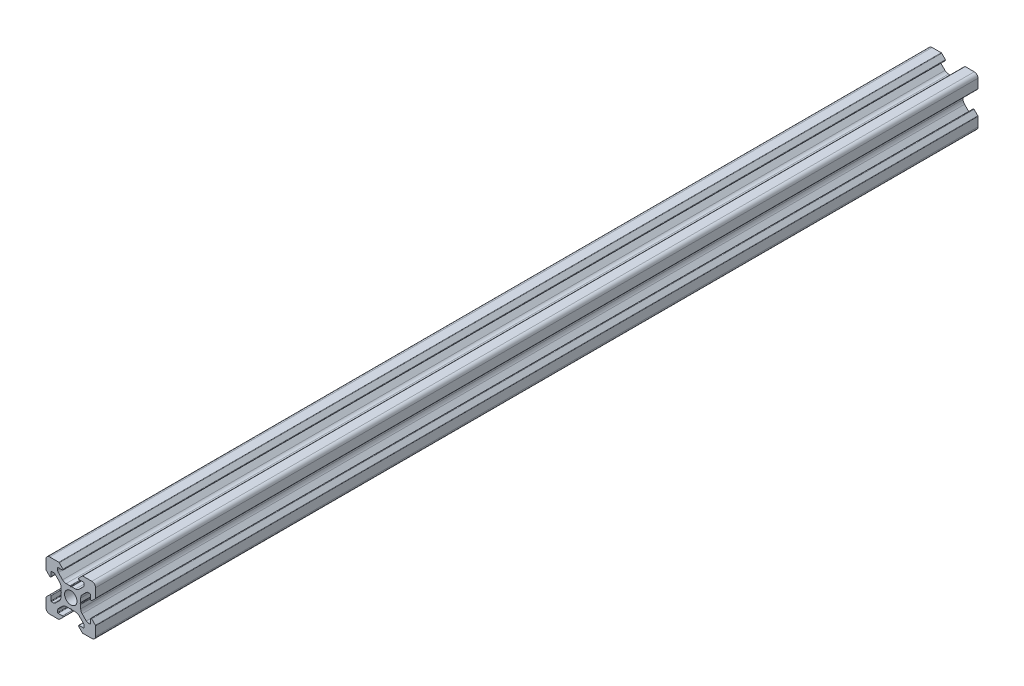
from build123d import *

# Parameters (mm, degrees)
MODEL_R            = 2.5
EXTRUDE_BODY_DEPTH = 356


with BuildPart() as part:
    # Model → Extrude body (new body)
    with BuildSketch(Plane.XY):
        with BuildLine():
            Line((-4, 0.337695265), (-4, 1.898780669))
            ThreePointArc((-4, 1.898780669), (-4.152240935, 2.664147534), (-4.585786438, 3.312994231))
            Line((-4.585786438, 3.312994231), (-6.279898987, 5.007106781))
            ThreePointArc((-6.279898987, 5.007106781), (-6.604322336, 5.223879533), (-6.987005769, 5.3))
            Line((-6.987005769, 5.3), (-7.8, 5.3))
            ThreePointArc((-7.8, 5.3), (-7.941421356, 5.241421356), (-8, 5.1))
            Line((-8, 5.1), (-8, 3.33))
            ThreePointArc((-8, 3.33), (-8.154329142, 3.099030117), (-8.426776695, 3.153223305))
            Line((-8.426776695, 3.153223305), (-9.926776695, 4.653223305))
            ThreePointArc((-9.926776695, 4.653223305), (-9.980969883, 4.734329142), (-10, 4.83))
            Line((-10, 4.83), (-10, 8.5))
            ThreePointArc((-10, 8.5), (-9.560660172, 9.560660172), (-8.5, 10))
            Line((-8.5, 10), (-4.83, 10))
            ThreePointArc((-4.83, 10), (-4.734329142, 9.980969883), (-4.653223305, 9.926776695))
            Line((-4.653223305, 9.926776695), (-3.153223305, 8.426776695))
            ThreePointArc((-3.153223305, 8.426776695), (-3.099030117, 8.154329142), (-3.33, 8))
            Line((-3.33, 8), (-5.1, 8))
            ThreePointArc((-5.1, 8), (-5.241421356, 7.941421356), (-5.3, 7.8))
            Line((-5.3, 7.8), (-5.3, 6.987005769))
            ThreePointArc((-5.3, 6.987005769), (-5.223879533, 6.604322336), (-5.007106781, 6.279898987))
            Line((-5.007106781, 6.279898987), (-3.312994231, 4.585786438))
            ThreePointArc((-3.312994231, 4.585786438), (-2.664147534, 4.152240935), (-1.898780669, 4))
            Line((-1.898780669, 4), (-0.337695265, 4))
            ThreePointArc((-0.337695265, 4), (-0.254943529, 3.98590708), (-0.181521503, 3.945217202))
            Line((-0.181521503, 3.945217202), (0, 3.8))
            Line((0, 3.8), (0.181521503, 3.945217202))
            ThreePointArc((0.181521503, 3.945217202), (0.254943529, 3.98590708), (0.337695265, 4))
            Line((0.337695265, 4), (1.898780669, 4))
            ThreePointArc((1.898780669, 4), (2.664147534, 4.152240935), (3.312994231, 4.585786438))
            Line((3.312994231, 4.585786438), (5.007106781, 6.279898987))
            ThreePointArc((5.007106781, 6.279898987), (5.223879533, 6.604322336), (5.3, 6.987005769))
            Line((5.3, 6.987005769), (5.3, 7.8))
            ThreePointArc((5.3, 7.8), (5.241421356, 7.941421356), (5.1, 8))
            Line((5.1, 8), (3.33, 8))
            ThreePointArc((3.33, 8), (3.099030117, 8.154329142), (3.153223305, 8.426776695))
            Line((3.153223305, 8.426776695), (4.653223305, 9.926776695))
            ThreePointArc((4.653223305, 9.926776695), (4.734329142, 9.980969883), (4.83, 10))
            Line((4.83, 10), (8.5, 10))
            ThreePointArc((8.5, 10), (9.560660172, 9.560660172), (10, 8.5))
            Line((10, 8.5), (10, 4.83))
            ThreePointArc((10, 4.83), (9.980969883, 4.734329142), (9.926776695, 4.653223305))
            Line((9.926776695, 4.653223305), (8.426776695, 3.153223305))
            ThreePointArc((8.426776695, 3.153223305), (8.154329142, 3.099030117), (8, 3.33))
            Line((8, 3.33), (8, 5.1))
            ThreePointArc((8, 5.1), (7.941421356, 5.241421356), (7.8, 5.3))
            Line((7.8, 5.3), (6.987005769, 5.3))
            ThreePointArc((6.987005769, 5.3), (6.604322336, 5.223879533), (6.279898987, 5.007106781))
            Line((6.279898987, 5.007106781), (4.585786438, 3.312994231))
            ThreePointArc((4.585786438, 3.312994231), (4.152240935, 2.664147534), (4, 1.898780669))
            Line((4, 1.898780669), (4, 0.337695265))
            ThreePointArc((4, 0.337695265), (3.98590708, 0.254943529), (3.945217202, 0.181521503))
            Line((3.945217202, 0.181521503), (3.8, 0))
            Line((3.8, 0), (3.945217202, -0.181521503))
            ThreePointArc((3.945217202, -0.181521503), (3.98590708, -0.254943529), (4, -0.337695265))
            Line((4, -0.337695265), (4, -1.898780669))
            ThreePointArc((4, -1.898780669), (4.152240935, -2.664147534), (4.585786438, -3.312994231))
            Line((4.585786438, -3.312994231), (6.279898987, -5.007106781))
            ThreePointArc((6.279898987, -5.007106781), (6.604322336, -5.223879533), (6.987005769, -5.3))
            Line((6.987005769, -5.3), (7.8, -5.3))
            ThreePointArc((7.8, -5.3), (7.941421356, -5.241421356), (8, -5.1))
            Line((8, -5.1), (8, -3.33))
            ThreePointArc((8, -3.33), (8.154329142, -3.099030117), (8.426776695, -3.153223305))
            Line((8.426776695, -3.153223305), (9.926776695, -4.653223305))
            ThreePointArc((9.926776695, -4.653223305), (9.980969883, -4.734329142), (10, -4.83))
            Line((10, -4.83), (10, -8.5))
            ThreePointArc((10, -8.5), (9.560660172, -9.560660172), (8.5, -10))
            Line((8.5, -10), (4.83, -10))
            ThreePointArc((4.83, -10), (4.734329142, -9.980969883), (4.653223305, -9.926776695))
            Line((4.653223305, -9.926776695), (3.153223305, -8.426776695))
            ThreePointArc((3.153223305, -8.426776695), (3.099030117, -8.154329142), (3.33, -8))
            Line((3.33, -8), (5.1, -8))
            ThreePointArc((5.1, -8), (5.241421356, -7.941421356), (5.3, -7.8))
            Line((5.3, -7.8), (5.3, -6.987005769))
            ThreePointArc((5.3, -6.987005769), (5.223879533, -6.604322336), (5.007106781, -6.279898987))
            Line((5.007106781, -6.279898987), (3.312994231, -4.585786438))
            ThreePointArc((3.312994231, -4.585786438), (2.664147534, -4.152240935), (1.898780669, -4))
            Line((1.898780669, -4), (0.337695265, -4))
            ThreePointArc((0.337695265, -4), (0.254943529, -3.98590708), (0.181521503, -3.945217202))
            Line((0.181521503, -3.945217202), (0, -3.8))
            Line((0, -3.8), (-0.181521503, -3.945217202))
            ThreePointArc((-0.181521503, -3.945217202), (-0.254943529, -3.98590708), (-0.337695265, -4))
            Line((-0.337695265, -4), (-1.898780669, -4))
            ThreePointArc((-1.898780669, -4), (-2.664147534, -4.152240935), (-3.312994231, -4.585786438))
            Line((-3.312994231, -4.585786438), (-5.007106781, -6.279898987))
            ThreePointArc((-5.007106781, -6.279898987), (-5.223879533, -6.604322336), (-5.3, -6.987005769))
            Line((-5.3, -6.987005769), (-5.3, -7.8))
            ThreePointArc((-5.3, -7.8), (-5.241421356, -7.941421356), (-5.1, -8))
            Line((-5.1, -8), (-3.33, -8))
            ThreePointArc((-3.33, -8), (-3.099030117, -8.154329142), (-3.153223305, -8.426776695))
            Line((-3.153223305, -8.426776695), (-4.653223305, -9.926776695))
            ThreePointArc((-4.653223305, -9.926776695), (-4.734329142, -9.980969883), (-4.83, -10))
            Line((-4.83, -10), (-8.5, -10))
            ThreePointArc((-8.5, -10), (-9.560660172, -9.560660172), (-10, -8.5))
            Line((-10, -8.5), (-10, -4.83))
            ThreePointArc((-10, -4.83), (-9.980969883, -4.734329142), (-9.926776695, -4.653223305))
            Line((-9.926776695, -4.653223305), (-8.426776695, -3.153223305))
            ThreePointArc((-8.426776695, -3.153223305), (-8.154329142, -3.099030117), (-8, -3.33))
            Line((-8, -3.33), (-8, -5.1))
            ThreePointArc((-8, -5.1), (-7.941421356, -5.241421356), (-7.8, -5.3))
            Line((-7.8, -5.3), (-6.987005769, -5.3))
            ThreePointArc((-6.987005769, -5.3), (-6.604322336, -5.223879533), (-6.279898987, -5.007106781))
            Line((-6.279898987, -5.007106781), (-4.585786438, -3.312994231))
            ThreePointArc((-4.585786438, -3.312994231), (-4.152240935, -2.664147534), (-4, -1.898780669))
            Line((-4, -1.898780669), (-4, -0.337695265))
            ThreePointArc((-4, -0.337695265), (-3.98590708, -0.254943529), (-3.945217202, -0.181521503))
            Line((-3.945217202, -0.181521503), (-3.8, 0))
            Line((-3.8, 0), (-3.945217202, 0.181521503))
            ThreePointArc((-3.945217202, 0.181521503), (-3.98590708, 0.254943529), (-4, 0.337695265))
        make_face()
        Circle(MODEL_R, mode=Mode.SUBTRACT)
    extrude(amount=EXTRUDE_BODY_DEPTH)


solid = part.part
